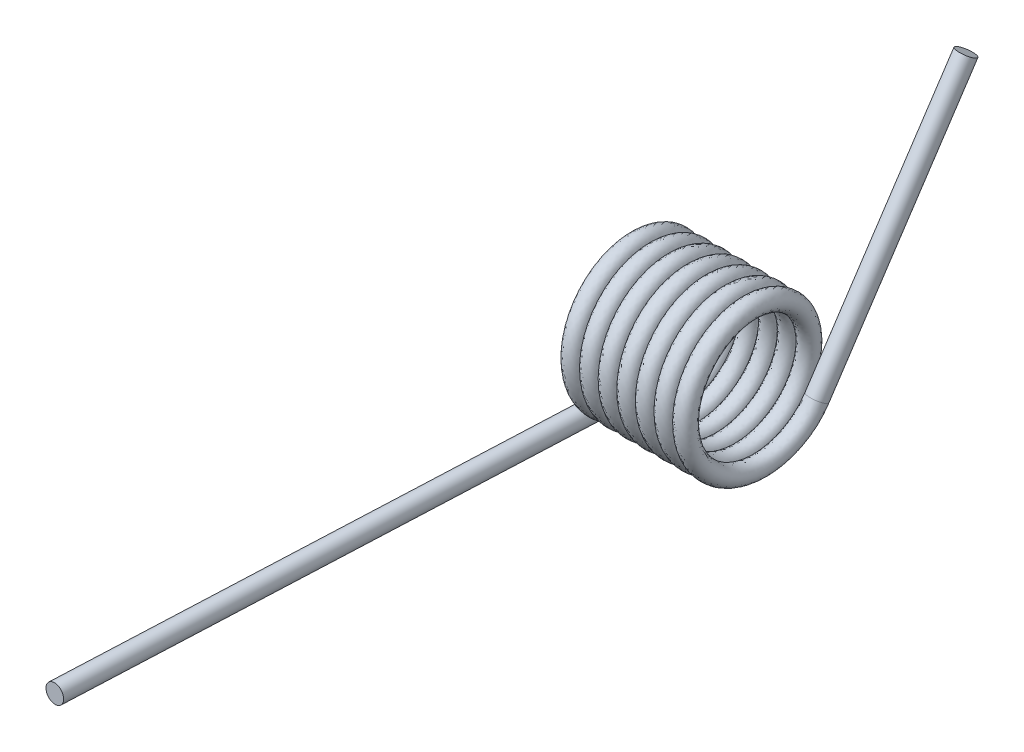
from build123d import *

# Parameters (mm, degrees)
SWEEP1_PITCH   = 3.4544
SKETCH4_R      = 1.7145
EXTRUDE1_DEPTH = 101.6
SKETCH5_R      = 1.7145
EXTRUDE2_DEPTH = 50.8


with BuildPart() as part:
    # Sweep1: the profile of Sketch3 screwed along a right-hand helix of 7.166667 turns, 6 arcs to a turn; built about Z, then put on its axis
    sweep1_z = Axis((0, 0, 0), (0, 0, 1))
    sweep1_corners = [(12.320738343, -0.07665633, 1.712322097), (13.994937093, 0.001781677, -0.039798483), (12.241061657, 0.07665633, -1.712322097), (10.566862907, -0.001781677, 0.039798483)]
    with BuildLine(mode=Mode.PRIVATE) as sweep1_profile:
        ThreePointArc((12.320738343, -0.07665633, 1.712322097), (13.521077214, -0.052944375, 1.182652789), (13.994937093, 0.001781677, -0.039798483))
        ThreePointArc((13.994937093, 0.001781677, -0.039798483), (13.464737289, 0.055464047, -1.238936343), (12.241061657, 0.07665633, -1.712322097))
        ThreePointArc((12.241061657, 0.07665633, -1.712322097), (11.040722786, 0.052944375, -1.182652789), (10.566862907, -0.001781677, 0.039798483))
        ThreePointArc((10.566862907, -0.001781677, 0.039798483), (11.097062711, -0.055464047, 1.238936343), (12.320738343, -0.07665633, 1.712322097))
    sweep1_cap = Face(sweep1_profile.wire())
    sweep1_arcs = [((12.320738343, -0.07665633, 1.712322097), (14.034775436, -0.074874653, 1.672523614), (13.994937093, 0.001781677, -0.039798483), (1, 0.7071067811865476, 1)), ((13.994937093, 0.001781677, -0.039798483), (13.95509875, 0.078438007, -1.75212058), (12.241061657, 0.07665633, -1.712322097), (1, 0.7071067811865476, 1)), ((12.241061657, 0.07665633, -1.712322097), (10.527024564, 0.074874653, -1.672523614), (10.566862907, -0.001781677, 0.039798483), (1, 0.7071067811865476, 1)), ((10.566862907, -0.001781677, 0.039798483), (10.60670125, -0.078438007, 1.75212058), (12.320738343, -0.07665633, 1.712322097), (1, 0.7071067811865476, 1))]  # start, shoulder, end, weights
    sweep1_turn_angles = [0, 30, 60, 90, 120, 150, 180, 210, 240, 270, 300, 330, 360]
    sweep1_turn_weights = [1, 0.8660254037844387, 1, 0.8660254037844387, 1, 0.8660254037844387, 1, 0.8660254037844387, 1, 0.8660254037844387, 1, 0.8660254037844387, 1]
    sweep1_turn_sides = [Face.make_bezier_surface([[Vector(p[j][0], p[j][1], 0).rotate(sweep1_z, sweep1_turn_angles[2 * i + k]) / sweep1_turn_weights[2 * i + k] + Vector(0, 0, p[j][2] + SWEEP1_PITCH * sweep1_turn_angles[2 * i + k] / 360) for k in range(3)] for j in range(3)], [[p[3][j] * sweep1_turn_weights[2 * i + k] for k in range(3)] for j in range(3)]) for p in sweep1_arcs for i in range(6)]
    sweep1_last_angles = [2520, 2550, 2580]
    sweep1_last_weights = [1, 0.8660254037844287, 1]
    sweep1_last_sides = [Face.make_bezier_surface([[Vector(p[j][0], p[j][1], 0).rotate(sweep1_z, sweep1_last_angles[2 * i + k]) / sweep1_last_weights[2 * i + k] + Vector(0, 0, p[j][2] + SWEEP1_PITCH * sweep1_last_angles[2 * i + k] / 360) for k in range(3)] for j in range(3)], [[p[3][j] * sweep1_last_weights[2 * i + k] for k in range(3)] for j in range(3)]) for p in sweep1_arcs for i in range(1)]
    sweep1 = Plane(origin=(0, 0, 0), x_dir=(0, -1, 0), z_dir=(1, 0, 0)) * Solid(Shell([*[p.moved(Location((0, 0, SWEEP1_PITCH * i))) for i in range(7) for p in sweep1_turn_sides], *sweep1_last_sides, sweep1_cap, sweep1_cap.rotate(sweep1_z, 2580).moved(Location((0, 0, SWEEP1_PITCH * 2580 / 360)))]))
    add(sweep1)

    # Sketch4 → Extrude1 (add)
    with BuildSketch(Plane(origin=(0, 0, 0), x_dir=(-0.9987297153021847, 0.023236129092748706, -0.04471060363272385), z_dir=(-0.04472267854557101, -1.0787594775796269e-14, 0.9989994404521504))):
        with Locations(Location((-0.285360578, 12.277584215, 0), (0, 0, 181.33145196))):
            Circle(SKETCH4_R)
    extrude(amount=EXTRUDE1_DEPTH)

    # Sketch5 → Extrude2 (add)
    with BuildSketch(Plane(origin=(0.049515987, 0.957885311, -0.553035342), x_dir=(0.9978855471315258, -0.062292740382097936, -0.018548566567365653), z_dir=(0.044722678545571014, 0.8651588937980695, -0.499499720225958))):
        with Locations(Location((25.283966872, 11.09962263, 0), (0, 0, 177.294066188))):
            Circle(SKETCH5_R)
    extrude(amount=EXTRUDE2_DEPTH)


solid = part.part
